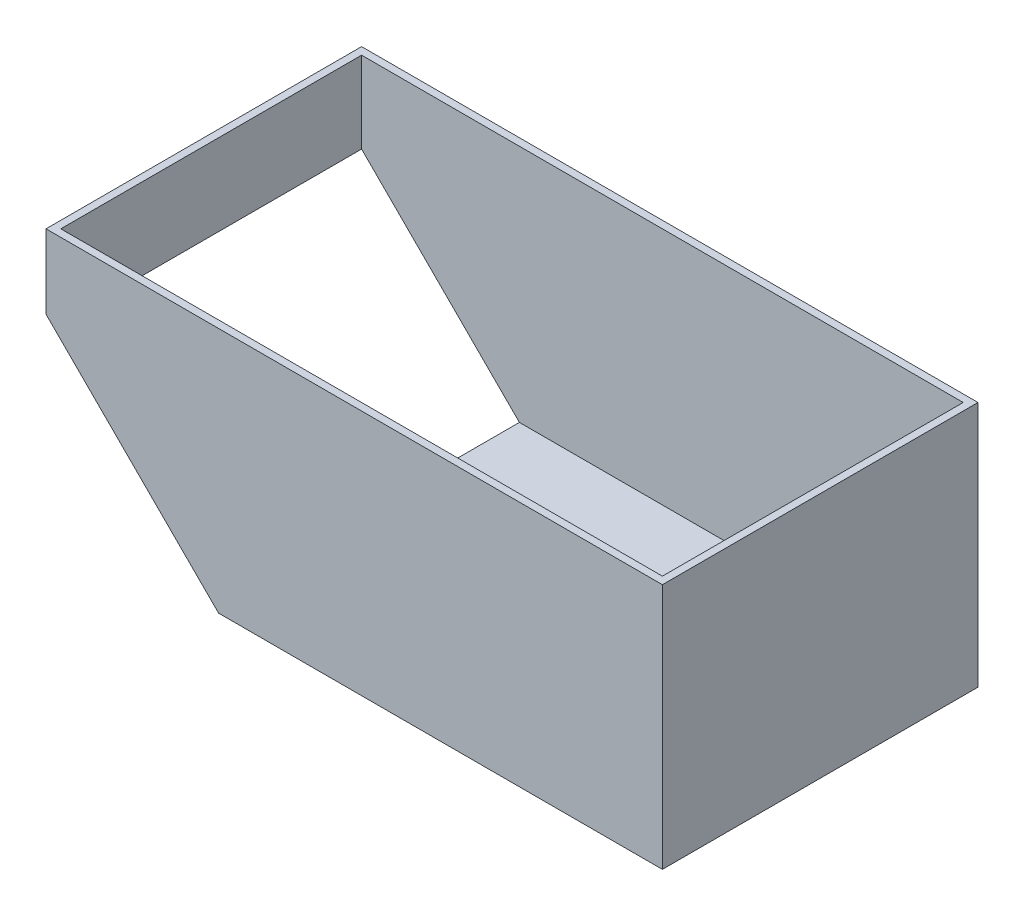
from build123d import *

# Parameters (mm, degrees)
SKETCH1_W               = 250
SKETCH1_H               = 128
BOSS_EXTRUDE1_DEPTH     = 3
SKETCH2_W               = 250
SKETCH2_H               = 128
SKETCH2_W_2             = 244
SKETCH2_H_2             = 122
BOSS_EXTRUDE2_DEPTH     = 100
CUT_EXTRUDE1_DEPTH      = 299.134197971
CUT_EXTRUDE1_DEPTH_BACK = 299.134197971


with BuildPart() as part:
    # Sketch1 → Boss-Extrude1 (new body)
    with BuildSketch(Plane(origin=(0, 0, 0), x_dir=(1, 0, 0), z_dir=(0, 1, 0))):
        with Locations((125, 64)):
            Rectangle(SKETCH1_W, SKETCH1_H)
    extrude(amount=BOSS_EXTRUDE1_DEPTH)

    # Sketch2 → Boss-Extrude2 (add)
    with BuildSketch(Plane(origin=(0, 0, 0), x_dir=(1, 0, 0), z_dir=(0, 1, 0))):
        with Locations((125, 64)):
            Rectangle(SKETCH2_W, SKETCH2_H)
        with Locations((125, 64)):
            Rectangle(SKETCH2_W_2, SKETCH2_H_2, mode=Mode.SUBTRACT)
    extrude(amount=BOSS_EXTRUDE2_DEPTH)

    # Sketch3 → Cut-Extrude1 (cut, two sides: drawn at the far end of the back side and taken through both)
    with BuildSketch(Plane.XY.offset(-CUT_EXTRUDE1_DEPTH_BACK)):
        Polygon((0, 70), (70, 0), (0, 0), align=None)
    extrude(amount=CUT_EXTRUDE1_DEPTH + CUT_EXTRUDE1_DEPTH_BACK, mode=Mode.SUBTRACT)


solid = part.part
